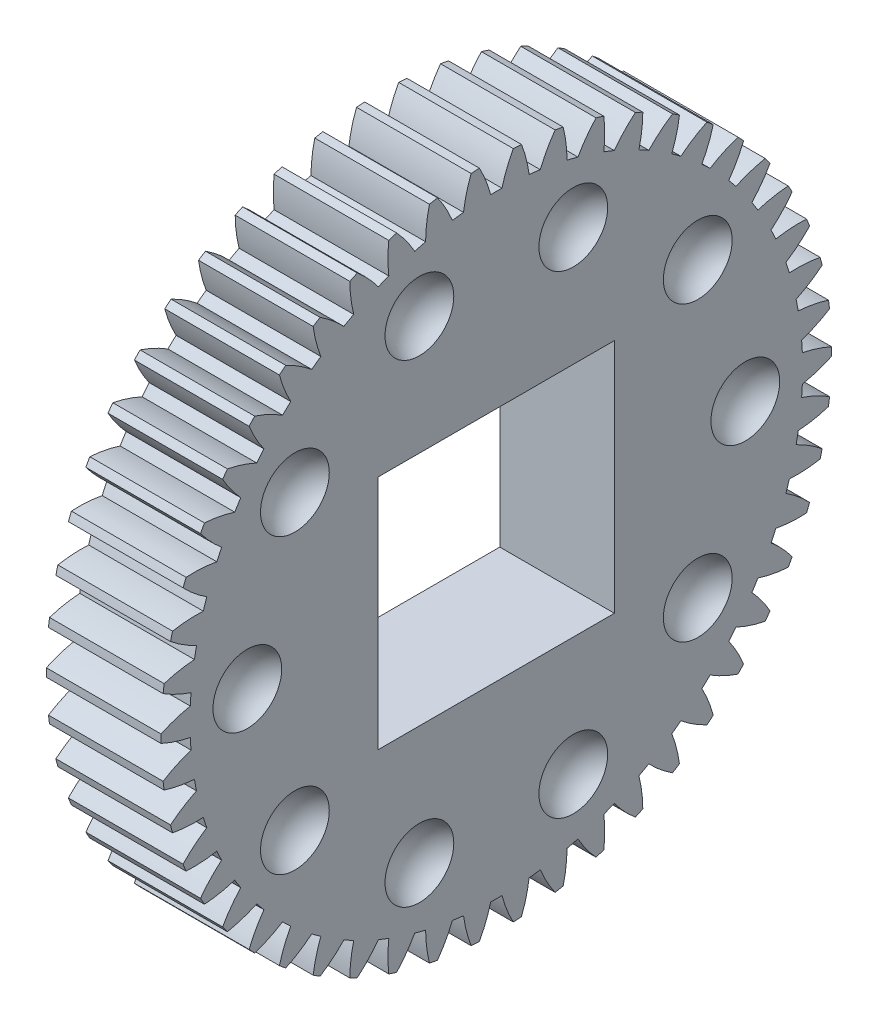
from build123d import *

# Parameters (mm, degrees)
BASPROSKE_W        = 10
BASPROSKE_H        = 29.25
TOOTHCUT_DEPTH     = 43.557314295
TEETHCUTS_COUNT    = 50
TEETHCUTS_ANGLE    = 352.8
BORSKE_R           = 0.4
BORE_DEPTH         = 50.0000508
SKETCH1_R          = 3
CUT_EXTRUDE1_DEPTH = 2
FILLET1_R          = 3.23
SKETCH2_R          = 24.71775
SKETCH2_R_2        = 18.71775
CUT_EXTRUDE2_DEPTH = 2
FILLET2_R          = 3.25
SKETCH3_W          = 20.6
SKETCH3_H          = 20.6
CUT_EXTRUDE3_DEPTH = 43.531602267


with BuildPart() as part:
    # BasProSke → Base-Revolve (revolve)
    with BuildSketch(Plane(origin=(0, 0, 0), x_dir=(1, 0, 0), z_dir=(0, 1, 0)), mode=Mode.PRIVATE) as base_revolve_sk:
        with Locations((5, 14.625)):
            Rectangle(BASPROSKE_W, BASPROSKE_H)
    revolve(base_revolve_sk.sketch.rotate(Axis((-10, 0, 0), (1, 0, 0)), 180), axis=Axis((-10, 0, 0), (1, 0, 0)))

    # TooCutSke → ToothCut (cut, through all)
    with BuildSketch(Plane(origin=(0, 0, 0), x_dir=(0, 0, -1), z_dir=(1, 0, 0))):
        with BuildLine():
            ThreePointArc((0.491156866, 26.713235109), (0, 26.71775), (-0.491156866, 26.713235109))
            ThreePointArc((-0.491156866, 26.713235109), (-0.915423228, 28.005606447), (-1.492562348, 29.237327217))
            ThreePointArc((-1.492562348, 29.237327217), (0, 29.2754), (1.492562348, 29.237327217))
            ThreePointArc((1.492562348, 29.237327217), (0.915423228, 28.005606447), (0.491156866, 26.713235109))
        make_face()
    toothcut = extrude(amount=TOOTHCUT_DEPTH, mode=Mode.SUBTRACT)

    # TeethCuts: ToothCut ×50 about axis
    teethcuts_axis = Axis((-10, 0, 0), (1, 0, 0))
    for i in range(1, TEETHCUTS_COUNT):
        add(toothcut.rotate(teethcuts_axis, i * TEETHCUTS_ANGLE / (TEETHCUTS_COUNT - 1)), mode=Mode.SUBTRACT)

    # BorSke → Bore (cut, symmetric)
    with BuildSketch(Plane(origin=(0, 0, 0), x_dir=(0, 0, -1), z_dir=(1, 0, 0))):
        with Locations(Location((0, 0, 0), (0, 0, 180))):
            Circle(BORSKE_R)
    extrude(amount=BORE_DEPTH, both=True, mode=Mode.SUBTRACT)

    # Sketch1 → Cut-Extrude1 (cut)
    with BuildSketch(Plane(origin=(10, 0, 0), x_dir=(0, 0, -1), z_dir=(1, 0, 0))):
        with Locations((-21.71775, 0)):
            Circle(SKETCH1_R)
        with Locations((-17.57002883, 12.765373163)):
            Circle(SKETCH1_R)
        with Locations((-6.71115383, 20.654807657)):
            Circle(SKETCH1_R)
        with Locations((6.71115383, 20.654807657)):
            Circle(SKETCH1_R)
        with Locations((17.57002883, 12.765373163)):
            Circle(SKETCH1_R)
        with Locations((21.71775, 0)):
            Circle(SKETCH1_R)
        with Locations((17.57002883, -12.765373163)):
            Circle(SKETCH1_R)
        with Locations((6.71115383, -20.654807657)):
            Circle(SKETCH1_R)
        with Locations((-6.71115383, -20.654807657)):
            Circle(SKETCH1_R)
        with Locations((-17.57002883, -12.765373163)):
            Circle(SKETCH1_R)
    extrude(amount=-CUT_EXTRUDE1_DEPTH, mode=Mode.SUBTRACT)

    # Fillet1
    # the kernel refuses this fillet: 3.23 mm, written as the material it adds along each edge
    with BuildSketch(Plane(origin=(8, 12.765373163, 17.57002883), x_dir=(0, 0, -1), z_dir=(0, -1, 0))) as fillet1_piece_1:
        with BuildLine():
            CenterArc((0.013363095, 3.23), FILLET1_R, 270, 67.616447755)
            Line((0.013363095, 0), (0.013363095, -0.0646))
            Line((0.013363095, -0.0646), (3, -0.0646))
            Line((3, -0.0646), (3.0646, 0))
            ThreePointArc((3.0646, 0), (3.0646, 1), (3.059732738, 1.9754))
            Line((3.059732738, 1.9754), (3, 2))
        make_face()
    revolve(axis=Axis((8, 12.765373163, 17.57002883), (1, 0, 0)))
    with BuildSketch(Plane(origin=(8, 20.654807657, 6.71115383), x_dir=(0, 0, -1), z_dir=(0, -1, 0))) as fillet1_piece_2:
        with BuildLine():
            CenterArc((0.013363095, 3.23), FILLET1_R, 270, 67.616447755)
            Line((0.013363095, 0), (0.013363095, -0.0646))
            Line((0.013363095, -0.0646), (3, -0.0646))
            Line((3, -0.0646), (3.0646, 0))
            ThreePointArc((3.0646, 0), (3.0646, 1), (3.059732738, 1.9754))
            Line((3.059732738, 1.9754), (3, 2))
        make_face()
    revolve(axis=Axis((8, 20.654807657, 6.71115383), (1, 0, 0)))
    with BuildSketch(Plane(origin=(8, 20.654807657, -6.71115383), x_dir=(0, 0, -1), z_dir=(0, -1, 0))) as fillet1_piece_3:
        with BuildLine():
            CenterArc((0.013363095, 3.23), FILLET1_R, 270, 67.616447755)
            Line((0.013363095, 0), (0.013363095, -0.0646))
            Line((0.013363095, -0.0646), (3, -0.0646))
            Line((3, -0.0646), (3.0646, 0))
            ThreePointArc((3.0646, 0), (3.0646, 1), (3.059732738, 1.9754))
            Line((3.059732738, 1.9754), (3, 2))
        make_face()
    revolve(axis=Axis((8, 20.654807657, -6.71115383), (1, 0, 0)))
    with BuildSketch(Plane(origin=(8, 12.765373163, -17.57002883), x_dir=(0, 0, -1), z_dir=(0, -1, 0))) as fillet1_piece_4:
        with BuildLine():
            CenterArc((0.013363095, 3.23), FILLET1_R, 270, 67.616447755)
            Line((0.013363095, 0), (0.013363095, -0.0646))
            Line((0.013363095, -0.0646), (3, -0.0646))
            Line((3, -0.0646), (3.0646, 0))
            ThreePointArc((3.0646, 0), (3.0646, 1), (3.059732738, 1.9754))
            Line((3.059732738, 1.9754), (3, 2))
        make_face()
    revolve(axis=Axis((8, 12.765373163, -17.57002883), (1, 0, 0)))
    with BuildSketch(Plane(origin=(8, 0, -21.71775), x_dir=(0, 0, -1), z_dir=(0, -1, 0))) as fillet1_piece_5:
        with BuildLine():
            CenterArc((0.013363095, 3.23), FILLET1_R, 270, 67.616447755)
            Line((0.013363095, 0), (0.013363095, -0.0646))
            Line((0.013363095, -0.0646), (3, -0.0646))
            Line((3, -0.0646), (3.0646, 0))
            ThreePointArc((3.0646, 0), (3.0646, 1), (3.059732738, 1.9754))
            Line((3.059732738, 1.9754), (3, 2))
        make_face()
    revolve(axis=Axis((8, 0, -21.71775), (1, 0, 0)))
    with BuildSketch(Plane(origin=(8, -12.765373163, -17.57002883), x_dir=(0, 0, -1), z_dir=(0, -1, 0))) as fillet1_piece_6:
        with BuildLine():
            CenterArc((0.013363095, 3.23), FILLET1_R, 270, 67.616447755)
            Line((0.013363095, 0), (0.013363095, -0.0646))
            Line((0.013363095, -0.0646), (3, -0.0646))
            Line((3, -0.0646), (3.0646, 0))
            ThreePointArc((3.0646, 0), (3.0646, 1), (3.059732738, 1.9754))
            Line((3.059732738, 1.9754), (3, 2))
        make_face()
    revolve(axis=Axis((8, -12.765373163, -17.57002883), (1, 0, 0)))
    with BuildSketch(Plane(origin=(8, -20.654807657, -6.71115383), x_dir=(0, 0, -1), z_dir=(0, -1, 0))) as fillet1_piece_7:
        with BuildLine():
            CenterArc((0.013363095, 3.23), FILLET1_R, 270, 67.616447755)
            Line((0.013363095, 0), (0.013363095, -0.0646))
            Line((0.013363095, -0.0646), (3, -0.0646))
            Line((3, -0.0646), (3.0646, 0))
            ThreePointArc((3.0646, 0), (3.0646, 1), (3.059732738, 1.9754))
            Line((3.059732738, 1.9754), (3, 2))
        make_face()
    revolve(axis=Axis((8, -20.654807657, -6.71115383), (1, 0, 0)))
    with BuildSketch(Plane(origin=(8, -20.654807657, 6.71115383), x_dir=(0, 0, -1), z_dir=(0, -1, 0))) as fillet1_piece_8:
        with BuildLine():
            CenterArc((0.013363095, 3.23), FILLET1_R, 270, 67.616447755)
            Line((0.013363095, 0), (0.013363095, -0.0646))
            Line((0.013363095, -0.0646), (3, -0.0646))
            Line((3, -0.0646), (3.0646, 0))
            ThreePointArc((3.0646, 0), (3.0646, 1), (3.059732738, 1.9754))
            Line((3.059732738, 1.9754), (3, 2))
        make_face()
    revolve(axis=Axis((8, -20.654807657, 6.71115383), (1, 0, 0)))
    with BuildSketch(Plane(origin=(8, -12.765373163, 17.57002883), x_dir=(0, 0, -1), z_dir=(0, -1, 0))) as fillet1_piece_9:
        with BuildLine():
            CenterArc((0.013363095, 3.23), FILLET1_R, 270, 67.616447755)
            Line((0.013363095, 0), (0.013363095, -0.0646))
            Line((0.013363095, -0.0646), (3, -0.0646))
            Line((3, -0.0646), (3.0646, 0))
            ThreePointArc((3.0646, 0), (3.0646, 1), (3.059732738, 1.9754))
            Line((3.059732738, 1.9754), (3, 2))
        make_face()
    revolve(axis=Axis((8, -12.765373163, 17.57002883), (1, 0, 0)))
    with BuildSketch(Plane(origin=(8, 0, 21.71775), x_dir=(0, 0, -1), z_dir=(0, -1, 0))) as fillet1_piece_10:
        with BuildLine():
            CenterArc((0.013363095, 3.23), FILLET1_R, 270, 67.616447755)
            Line((0.013363095, 0), (0.013363095, -0.0646))
            Line((0.013363095, -0.0646), (3, -0.0646))
            Line((3, -0.0646), (3.0646, 0))
            ThreePointArc((3.0646, 0), (3.0646, 1), (3.059732738, 1.9754))
            Line((3.059732738, 1.9754), (3, 2))
        make_face()
    revolve(axis=Axis((8, 0, 21.71775), (1, 0, 0)))

    # Sketch2 → Cut-Extrude2 (cut)
    with BuildSketch(Plane.ZY):
        Circle(SKETCH2_R)
        Circle(SKETCH2_R_2, mode=Mode.SUBTRACT)
    extrude(amount=-CUT_EXTRUDE2_DEPTH, mode=Mode.SUBTRACT)

    # Fillet2
    # the kernel refuses this fillet: 3.25 mm, written as the material it adds along each edge
    with BuildSketch(Plane(origin=(2, 0, 0), x_dir=(0, 0, 1), z_dir=(0, -1, 0))) as fillet2_piece_1:
        with BuildLine():
            CenterArc((21.71775, 3.25), FILLET2_R, 270, 67.380135052)
            Line((21.71775, 0), (21.71775, -0.065))
            Line((21.71775, -0.065), (24.71775, -0.065))
            Line((24.71775, -0.065), (24.78275, 0))
            ThreePointArc((24.78275, 0), (24.78275, 1), (24.77775, 1.975))
            Line((24.77775, 1.975), (24.71775, 2))
        make_face()
    revolve(axis=Axis((2, 0, 0), (-1, 0, 0)))
    with BuildSketch(Plane(origin=(2, 0, 0), x_dir=(0, 0, 1), z_dir=(0, -1, 0))) as fillet2_piece_2:
        with BuildLine():
            CenterArc((21.71775, 3.25), FILLET2_R, 202.619864948, 67.380135052)
            Line((21.71775, 0), (21.71775, -0.065))
            Line((21.71775, -0.065), (18.71775, -0.065))
            Line((18.71775, -0.065), (18.65275, 0))
            ThreePointArc((18.65275, 0), (18.65275, 1), (18.65775, 1.975))
            Line((18.65775, 1.975), (18.71775, 2))
        make_face()
    revolve(axis=Axis((2, 0, 0), (-1, 0, 0)))

    # Sketch3 → Cut-Extrude3 (cut, through all)
    with BuildSketch(Plane(origin=(10, 0, 0), x_dir=(0, 0, -1), z_dir=(1, 0, 0))):
        Rectangle(SKETCH3_W, SKETCH3_H)
    extrude(amount=-CUT_EXTRUDE3_DEPTH, mode=Mode.SUBTRACT)


solid = part.part
